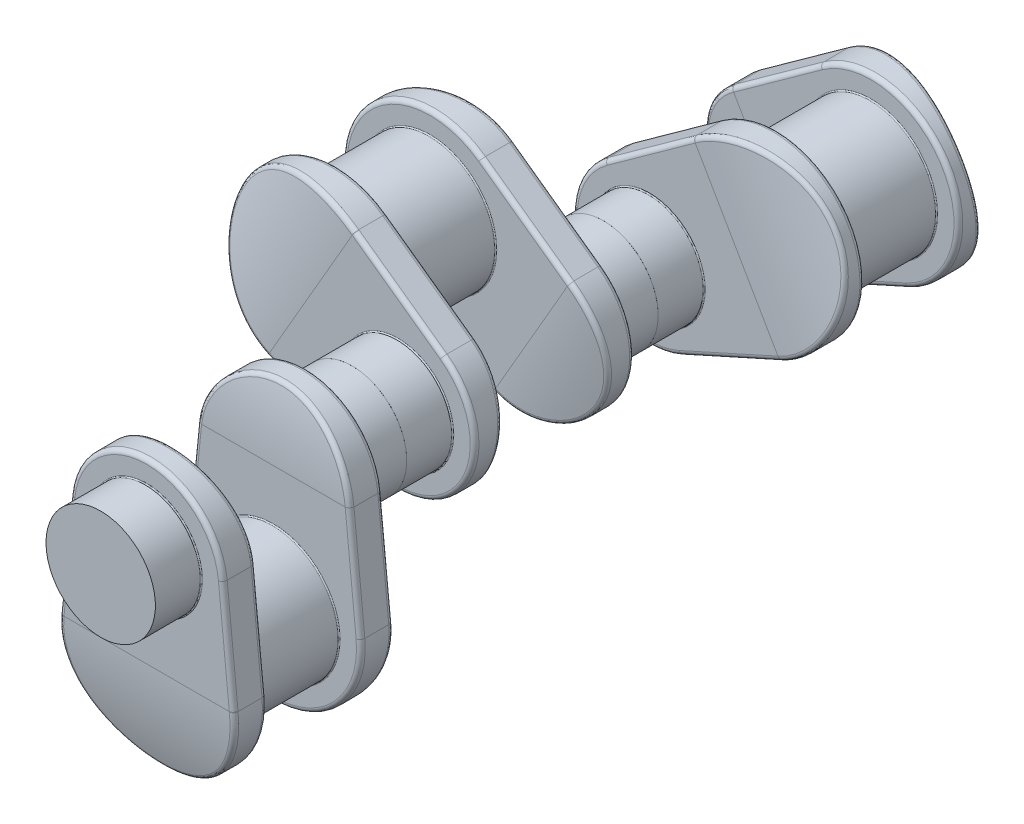
from build123d import *

# Parameters (mm, degrees)
SKETCH1_R             = 38.1
BOSS_EXTRUDE1_DEPTH   = 27.3
BOSS_EXTRUDE2_DEPTH   = 19
SKETCH4_R             = 31.75
BOSS_EXTRUDE3_DEPTH   = 26.67
CUT_EXTRUDE1_DEPTH    = 500
CUT_EXTRUDE2_DEPTH    = 500
FILLET1_R             = 2.54
FILLET2_R             = 0.64
LPATTERN1_COUNT       = 3
LPATTERN1_PITCH       = 145.96
BODY_MOVE_COPY1_ANGLE = 120
BODY_MOVE_COPY2_ANGLE = 120


with BuildPart() as part:
    # Sketch1 → Boss-Extrude1 (new body)
    with BuildSketch(Plane.XY):
        Circle(SKETCH1_R)
    extrude(amount=BOSS_EXTRUDE1_DEPTH)

    # Sketch3 → Boss-Extrude2 (add)
    with BuildSketch(Plane.XY.offset(27.3)):
        with BuildLine():
            Line((-44.227191579, 67.945), (-50.545361805, 5.08))
            ThreePointArc((-50.545361805, 5.08), (0, -50.8), (50.545361805, 5.08))
            Line((50.545361805, 5.08), (44.227191579, 67.945))
            ThreePointArc((44.227191579, 67.945), (0, 107.95), (-44.227191579, 67.945))
        make_face()
    extrude(amount=BOSS_EXTRUDE2_DEPTH)

    # Sketch4 → Boss-Extrude3 (add)
    with BuildSketch(Plane.XY.offset(46.3)):
        with Locations((0, 63.5)):
            Circle(SKETCH4_R)
    extrude(amount=BOSS_EXTRUDE3_DEPTH)

    # Sketch7 → Cut-Extrude1 (cut, symmetric)
    with BuildSketch(Plane(origin=(0, 0, 0), x_dir=(0, 0, -1), z_dir=(1, 0, 0))):
        with BuildLine():
            Line((-46.3, 5.08), (-70.388905772, 5.08))
            Line((-70.388905772, 5.08), (-70.388905772, -50.8))
            Line((-70.388905772, -50.8), (-36.8, -50.8))
            ThreePointArc((-36.8, -50.8), (-43.90944182, -23.261121999), (-46.3, 5.08))
        make_face()
    extrude(amount=CUT_EXTRUDE1_DEPTH, both=True, mode=Mode.SUBTRACT)

    # Sketch8 → Cut-Extrude2 (cut, symmetric)
    with BuildSketch(Plane(origin=(0, 0, 0), x_dir=(0, 0, -1), z_dir=(1, 0, 0))):
        with BuildLine():
            Line((-32.3, 107.95), (-15.84418944, 107.95))
            Line((-15.84418944, 107.95), (-15.84418944, 67.945))
            Line((-15.84418944, 67.945), (-27.3, 67.945))
            ThreePointArc((-27.3, 67.945), (-28.602788868, 88.097132687), (-32.3, 107.95))
        make_face()
    extrude(amount=CUT_EXTRUDE2_DEPTH, both=True, mode=Mode.SUBTRACT)

    # Fillet1
    fillet1_edges = [part.edges().sort_by_distance(p)[0] for p in [
        (-47.386276692, 36.5125, 27.3),
        (0, -50.8, 27.3),
        (50.54699978, 5.063675864, 46.3),
        (37.651852766, -34.102463018, 41.698947212),
        (-50.54699978, 5.063675864, 46.3),
        (-47.386276692, 36.5125, 46.3),
        (0, 107.95, 46.3),
        (0, 107.95, 32.3),
        (47.386276692, 36.5125, 27.3),
        (47.386276692, 36.5125, 46.3),
    ]]
    fillet(fillet1_edges, radius=FILLET1_R)

    # Fillet2
    fillet2_edges = [part.edges().sort_by_distance(p)[0] for p in [
        (-38.1, 0, 27.3),
        (-31.75, 63.5, 46.3),
    ]]
    fillet(fillet2_edges, radius=FILLET2_R)

    # Mirror1: part across plane


with BuildPart() as part_1:
    add(part.part)
    add(part.part.mirror(Plane.XY))


with BuildPart() as lpattern1_1:
    # LPattern1: pattern copy
    add(part_1.part.moved(Location(Vector(0, 0, -1) * (1 * LPATTERN1_PITCH))))


with BuildPart() as lpattern1_2:
    # LPattern1: pattern copy
    add(part_1.part.moved(Location(Vector(0, 0, -1) * (2 * LPATTERN1_PITCH))))


with BuildPart() as lpattern1_1_1:
    # Body-Move/Copy1: moved
    add(lpattern1_1.part.rotate(Axis((0, 63.5, 0), (0, 0, -1)), BODY_MOVE_COPY1_ANGLE))


with BuildPart() as lpattern1_2_1:
    # Body-Move/Copy2: moved
    add(lpattern1_2.part.rotate(Axis((0, 63.5, 0), (0, 0, 1)), BODY_MOVE_COPY2_ANGLE))


solid = Compound([part_1.part, lpattern1_1_1.part, lpattern1_2_1.part])
